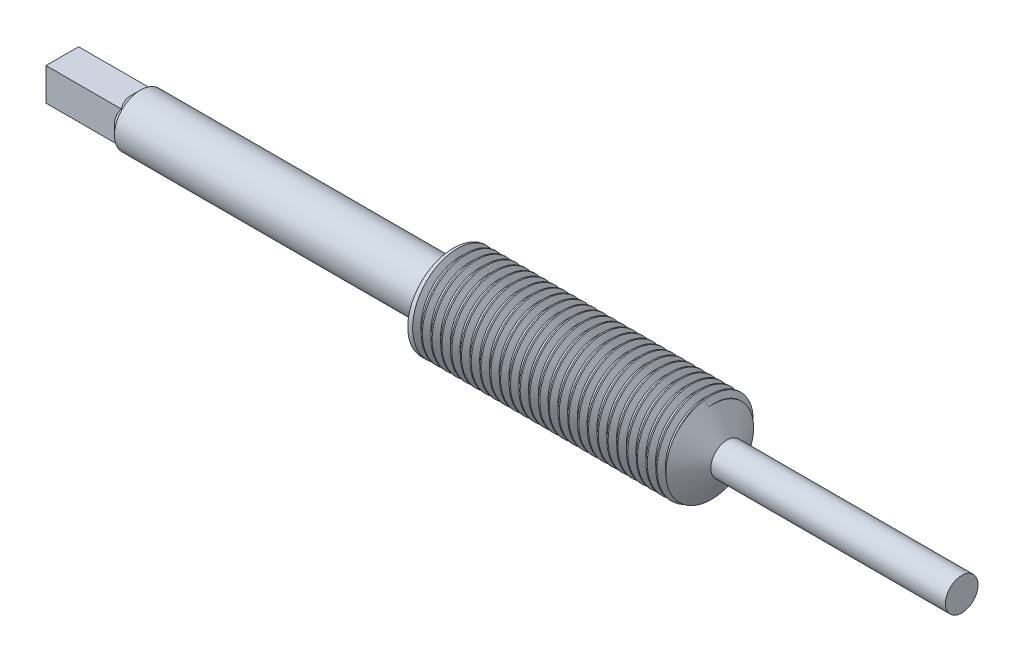
from build123d import *

# Parameters (mm, degrees)
SKETCH_2_W      = 5
SKETCH_2_H      = 5
EXTRUDE_1_DEPTH = 10
CHAMFER_1_SIZE  = 2
THREAD_1_PITCH  = 1.5


with BuildPart() as part:
    # Sketch 1 → 旋转3 (revolve)
    with BuildSketch(Plane.XY, mode=Mode.PRIVATE) as revolve_3_sk:
        Polygon((-47.724279124, 0), (-47.724279124, 4), (2.275720876, 4), (2.275720876, 7), (41.677644665, 7), (44.275720876, 2.5), (80.275720876, 2.5), (80.275720876, 0), align=None)
    revolve(revolve_3_sk.sketch.rotate(Axis((0, 0, 0), (1, 0, 0)), 90), axis=Axis((0, 0, 0), (1, 0, 0)))

    # 草图2 → 凸台-拉伸1 (add)
    with BuildSketch(Plane.ZY.offset(47.724279124)):
        Rectangle(SKETCH_2_W, SKETCH_2_H)
    extrude(amount=EXTRUDE_1_DEPTH)

    # 倒角1
    # the kernel refuses this chamfer: 2 mm, written as the material it takes off along each edge
    with BuildSketch(Plane(origin=(-47.724279124, 0, 0), x_dir=(0, 0, 1), z_dir=(0, 1, 0))) as chamfer_1_piece_1_section:
        Polygon((4 - CHAMFER_1_SIZE, 0), (4, CHAMFER_1_SIZE), (4, 0), align=None)
    chamfer_1_piece_1 = revolve(axis=Axis((-47.724279124, 0, 0), (1, 0, 0)), mode=Mode.PRIVATE)
    chamfer_1_piece_1 = split(chamfer_1_piece_1, bisect_by=Plane(origin=(-46.973007917, 0, 2.5), z_dir=(0, 0, 1)), keep=Keep.TOP, mode=Mode.PRIVATE)
    add(chamfer_1_piece_1, mode=Mode.SUBTRACT)
    with BuildSketch(Plane(origin=(-47.724279124, 0, 0), x_dir=(0, 0, 1), z_dir=(0, 1, 0))) as chamfer_1_piece_2_section:
        Polygon((4 - CHAMFER_1_SIZE, 0), (4, CHAMFER_1_SIZE), (4, 0), align=None)
    chamfer_1_piece_2 = revolve(axis=Axis((-47.724279124, 0, 0), (1, 0, 0)), mode=Mode.PRIVATE)
    chamfer_1_piece_2 = split(chamfer_1_piece_2, bisect_by=Plane(origin=(-46.973007917, -2.5, 0), z_dir=(0, -1, 0)), keep=Keep.TOP, mode=Mode.PRIVATE)
    add(chamfer_1_piece_2, mode=Mode.SUBTRACT)
    with BuildSketch(Plane(origin=(-47.724279124, 0, 0), x_dir=(0, 0, 1), z_dir=(0, 1, 0))) as chamfer_1_piece_3_section:
        Polygon((4 - CHAMFER_1_SIZE, 0), (4, CHAMFER_1_SIZE), (4, 0), align=None)
    chamfer_1_piece_3 = revolve(axis=Axis((-47.724279124, 0, 0), (1, 0, 0)), mode=Mode.PRIVATE)
    chamfer_1_piece_3 = split(chamfer_1_piece_3, bisect_by=Plane(origin=(-46.973007917, 0, -2.5), z_dir=(0, 0, -1)), keep=Keep.TOP, mode=Mode.PRIVATE)
    add(chamfer_1_piece_3, mode=Mode.SUBTRACT)
    with BuildSketch(Plane(origin=(-47.724279124, 0, 0), x_dir=(0, 0, 1), z_dir=(0, 1, 0))) as chamfer_1_piece_4_section:
        Polygon((4 - CHAMFER_1_SIZE, 0), (4, CHAMFER_1_SIZE), (4, 0), align=None)
    chamfer_1_piece_4 = revolve(axis=Axis((-47.724279124, 0, 0), (1, 0, 0)), mode=Mode.PRIVATE)
    chamfer_1_piece_4 = split(chamfer_1_piece_4, bisect_by=Plane(origin=(-46.973007917, 2.5, 0), z_dir=(0, 1, 0)), keep=Keep.TOP, mode=Mode.PRIVATE)
    add(chamfer_1_piece_4, mode=Mode.SUBTRACT)

    # 螺纹线1: the profile of Sketch 1 2 profile screwed along a right-hand helix of 28 turns, 8 arcs to a turn; built about Z, then put on its axis
    thread_1_z = Axis((0, 0, 0), (0, 0, 1))
    thread_1_corners = [(7.0003, 0, -0.000173205), (7.0003, 0, 1.312673201), (6.188101187, 0, 0.843749998), (6.188101187, 0, 0.468749998)]
    with BuildLine(mode=Mode.PRIVATE) as thread_1_profile:
        Line(thread_1_corners[0], thread_1_corners[1])
        Line(thread_1_corners[1], thread_1_corners[2])
        Line(thread_1_corners[2], thread_1_corners[3])
        Line(thread_1_corners[3], thread_1_corners[0])
    thread_1_cap = Face(thread_1_profile.wire())
    thread_1_turn_angles = [0, 22.5, 45, 67.5, 90, 112.5, 135, 157.5, 180, 202.5, 225, 247.5, 270, 292.5, 315, 337.5, 360]
    thread_1_turn_weights = [1, 0.9238795325112867, 1, 0.9238795325112867, 1, 0.9238795325112867, 1, 0.9238795325112867, 1, 0.9238795325112867, 1, 0.9238795325112867, 1, 0.9238795325112867, 1, 0.9238795325112867, 1]
    thread_1_turn_rails = [Edge.make_bspline([Vector(p[0], p[1], 0).rotate(thread_1_z, thread_1_turn_angles[k]) / thread_1_turn_weights[k] + Vector(0, 0, p[2] + THREAD_1_PITCH * thread_1_turn_angles[k] / 360) for k in range(17)], [0, 0, 0, 1, 1, 2, 2, 3, 3, 4, 4, 5, 5, 6, 6, 7, 7, 8, 8, 8], 2, thread_1_turn_weights) for p in thread_1_corners]
    thread_1_turn_sides = [Face.make_surface_from_curves(thread_1_turn_rails[p[0]], thread_1_turn_rails[p[1]]) for p in [(0, 1), (1, 2), (2, 3), (3, 0)]]
    thread_1 = Plane(origin=(2.275720876, 0, 0), x_dir=(0, 0, -1), z_dir=(1, 0, 0)) * Solid(Shell([*[p.moved(Location((0, 0, THREAD_1_PITCH * i))) for i in range(28) for p in thread_1_turn_sides], thread_1_cap, thread_1_cap.rotate(thread_1_z, 10080).moved(Location((0, 0, THREAD_1_PITCH * 10080 / 360)))]))
    add(thread_1, mode=Mode.SUBTRACT)


solid = part.part
